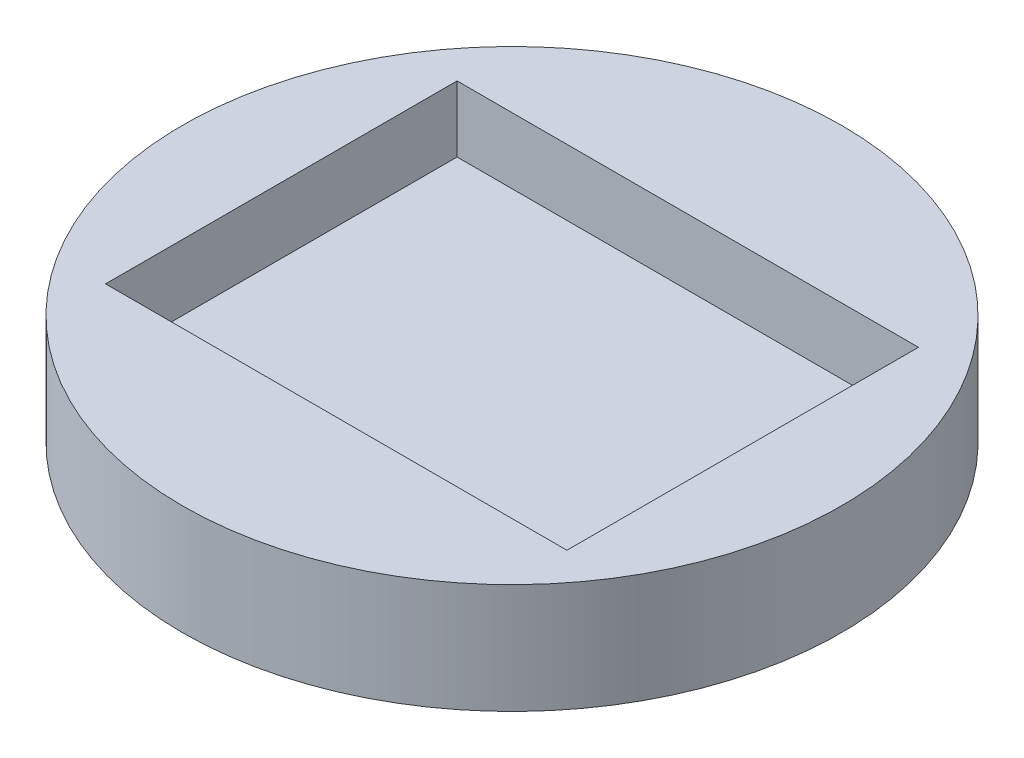
from build123d import *

# Parameters (mm, degrees)
CROQUIS2_W            = 21
CROQUIS2_H            = 16
CORTAR_EXTRUIR1_DEPTH = 3


with BuildPart() as part:
    # Croquis1 → Revolución1 (revolve)
    with BuildSketch(Plane.XY):
        Polygon((-15, 5), (-15, 0), (-10, 0), (0, 0), (0, 5), align=None)
    revolve(axis=Axis((0, 25.323006639, 0), (0, -1, 0)))

    # Croquis2 → Cortar-Extruir1 (cut)
    with BuildSketch(Plane(origin=(0, 5, 0), x_dir=(1, 0, 0), z_dir=(0, 1, 0))):
        Rectangle(CROQUIS2_W, CROQUIS2_H)
    extrude(amount=-CORTAR_EXTRUIR1_DEPTH, mode=Mode.SUBTRACT)


solid = part.part
